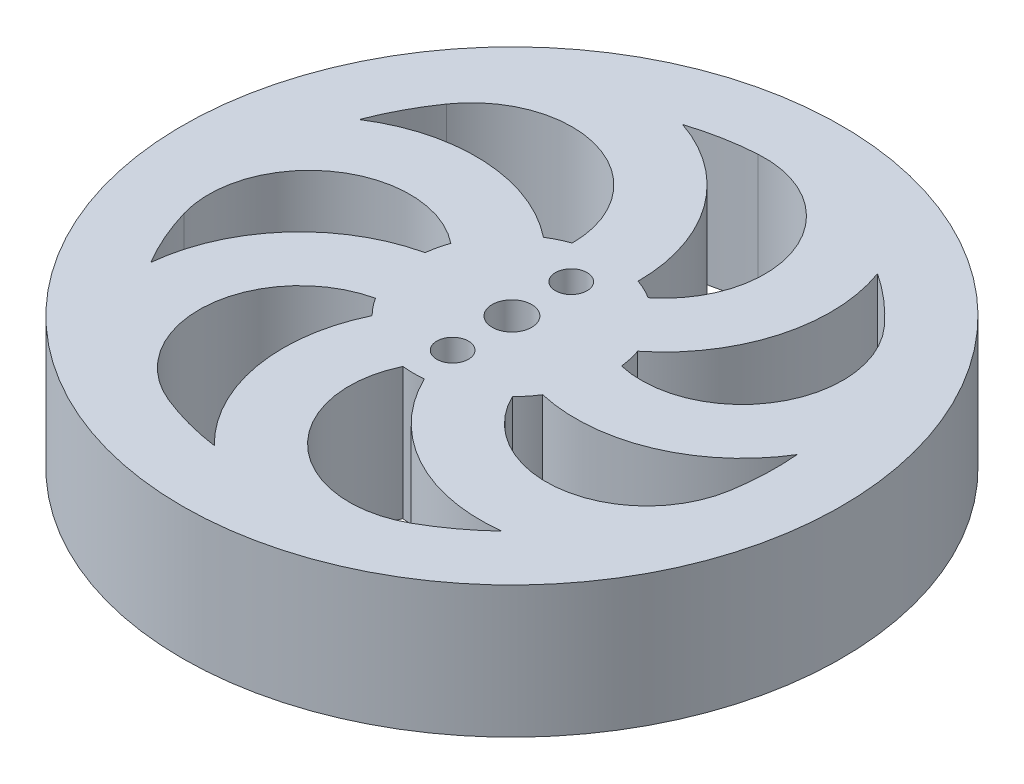
from build123d import *

# Parameters (mm, degrees)
BASE_REFERENCE_SKETCH_R       = 25
BASE_REFERENCE_SKETCH_R_2     = 1.5
BASE_WHEEL_EXTRUDE_DEPTH      = 10
SPOKES_CIRCULAR_PATTERN_COUNT = 7
M2_CLEARANCE_HOLE1_D          = 2.4
CIRPATTERN1_COUNT             = 2


with BuildPart() as part:
    # Base Reference Sketch → Base Wheel Extrude (new body)
    with BuildSketch(Plane(origin=(0, 0, 0), x_dir=(1, 0, 0), z_dir=(0, 1, 0))):
        Circle(BASE_REFERENCE_SKETCH_R)
        with BuildLine():
            ThreePointArc((-6.099694515, 19.047144847), (11.877442501, -16.091188882), (-16.404494382, 11.440828819))
            ThreePointArc((-16.404494382, 11.440828819), (-7.848653173, 14.358553237), (-2.5, 7.071067812))
            ThreePointArc((-2.5, 7.071067812), (0, -7.5), (2.5, 7.071067812))
            ThreePointArc((2.5, 7.071067812), (0.127377259, 14.442993729), (-6.099694515, 19.047144847))
        make_face(mode=Mode.SUBTRACT)
        Circle(BASE_REFERENCE_SKETCH_R_2, mode=Mode.SUBTRACT)
    base_wheel_extrude = extrude(amount=BASE_WHEEL_EXTRUDE_DEPTH)

    # Spokes Circular Pattern: Base Wheel Extrude ×7 about axis
    spokes_circular_pattern_axis = Axis((0, 10, 0), (0, -1, 0))
    for i in range(1, SPOKES_CIRCULAR_PATTERN_COUNT):
        add(base_wheel_extrude.rotate(spokes_circular_pattern_axis, i * 360 / SPOKES_CIRCULAR_PATTERN_COUNT))

    # M2 Clearance Hole1 (through all)
    with Locations(Plane(origin=(0, 0, 0), x_dir=(-1, 0, 0), z_dir=(0, -1, 0))):
        with Locations((0, 4.5)):
            m2_clearance_hole1 = Hole(M2_CLEARANCE_HOLE1_D / 2)

    # CirPattern1: M2 Clearance Hole1 ×2 about axis
    cirpattern1_axis = Axis((0, 10, 0), (0, -1, 0))
    for i in range(1, CIRPATTERN1_COUNT):
        add(m2_clearance_hole1.rotate(cirpattern1_axis, i * 360 / CIRPATTERN1_COUNT), mode=Mode.SUBTRACT)


solid = part.part
